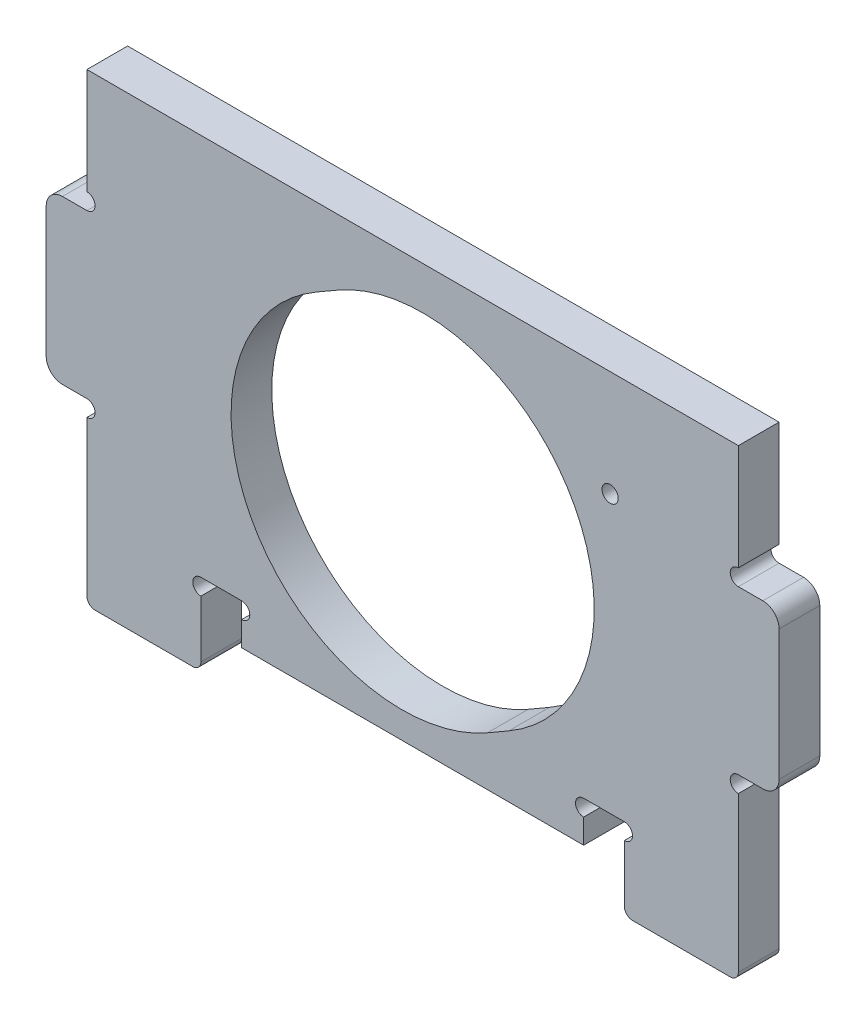
from build123d import *

# Parameters (mm, degrees)
SKETCH_1_W          = 80
SKETCH_1_H          = 52
EXTRUDE_1_DEPTH     = 5
CUT_EXTRUDE_4_DEPTH = 10
SKETCH_9_R          = 1
CUT_EXTRUDE_5_DEPTH = 10
SKETCH_10_W         = 5
SKETCH_10_H         = 5
CUT_EXTRUDE_6_DEPTH = 10
SKETCH_11_R         = 1
CUT_EXTRUDE_7_DEPTH = 10
SKETCH_12_W         = 5
SKETCH_12_H         = 20
EXTRUDE_4_DEPTH     = 5
SKETCH_13_R         = 1
CUT_EXTRUDE_8_DEPTH = 5
FILLET_2_R          = 2
SKETCH_14_W         = 14
SKETCH_14_H         = 5
EXTRUDE_5_DEPTH     = 5
FILLET_3_R          = 1


with BuildPart() as part:
    # 스케치1 → 보스-돌출1 (new body)
    with BuildSketch(Plane.XY):
        with Locations((-10, -8.537755654)):
            Rectangle(SKETCH_1_W, SKETCH_1_H)
    extrude(amount=EXTRUDE_1_DEPTH)

    # 스케치8 → 컷-돌출4 (cut)
    with BuildSketch(Plane(origin=(0, 0, 0), x_dir=(-1, 0, 0), z_dir=(0, 0, -1))):
        with BuildLine():
            Line((19.200961894, 9.398777825), (21.799038106, 7.898777825))
            ThreePointArc((21.799038106, 7.898777825), (29.485571585, -20.787755654), (0.799038106, -28.474289134))
            Line((0.799038106, -28.474289134), (-1.799038106, -26.974289134))
            ThreePointArc((-1.799038106, -26.974289134), (-9.485571585, 1.712244346), (19.200961894, 9.398777825))
        make_face()
    extrude(amount=-CUT_EXTRUDE_4_DEPTH, mode=Mode.SUBTRACT)

    # 스케치9 → 컷-돌출5 (cut)
    with BuildSketch(Plane(origin=(0, 0, 0), x_dir=(-1, 0, 0), z_dir=(0, 0, -1))):
        with Locations((-14.248711306, 4.462244346)):
            Circle(SKETCH_9_R)
    extrude(amount=-CUT_EXTRUDE_5_DEPTH, mode=Mode.SUBTRACT)

    # 스케치10 → 컷-돌출6 (cut)
    with BuildSketch(Plane.XY.offset(5)):
        with Locations((13.5, -32.037755654)):
            Rectangle(SKETCH_10_W, SKETCH_10_H)
        with Locations((-33.5, -32.037755654)):
            Rectangle(SKETCH_10_W, SKETCH_10_H)
    extrude(amount=-CUT_EXTRUDE_6_DEPTH, mode=Mode.SUBTRACT)

    # 스케치11 → 컷-돌출7 (cut)
    with BuildSketch(Plane(origin=(0, 0, 0), x_dir=(-1, 0, 0), z_dir=(0, 0, -1))):
        with Locations((-11, -30.537755654)):
            Circle(SKETCH_11_R)
        with Locations((-16, -30.537755654)):
            Circle(SKETCH_11_R)
        with Locations((31, -30.537755654)):
            Circle(SKETCH_11_R)
        with Locations((36, -30.537755654)):
            Circle(SKETCH_11_R)
    extrude(amount=-CUT_EXTRUDE_7_DEPTH, mode=Mode.SUBTRACT)

    # 스케치12 → 보스-돌출4 (add)
    with BuildSketch(Plane(origin=(0, 0, 0), x_dir=(-1, 0, 0), z_dir=(0, 0, -1))):
        with Locations((52.5, -7.537755654)):
            Rectangle(SKETCH_12_W, SKETCH_12_H)
        with Locations((-32.5, -7.537755654)):
            Rectangle(SKETCH_12_W, SKETCH_12_H)
    extrude(amount=-EXTRUDE_4_DEPTH)

    # 스케치13 → 컷-돌출8 (cut)
    with BuildSketch(Plane(origin=(0, 0, 0), x_dir=(-1, 0, 0), z_dir=(0, 0, -1))):
        with Locations((50, 3.462244346)):
            Circle(SKETCH_13_R)
        with Locations((50, -18.537755654)):
            Circle(SKETCH_13_R)
        with Locations((-30, 3.462244346)):
            Circle(SKETCH_13_R)
        with Locations((-30, -18.537755654)):
            Circle(SKETCH_13_R)
    extrude(amount=-CUT_EXTRUDE_8_DEPTH, mode=Mode.SUBTRACT)

    # 필렛2
    fillet_2_edges = [part.edges().sort_by_distance(p)[0] for p in [
        (35, -17.537755654, 2.5),
        (35, 2.462244346, 2.5),
        (-55, -17.537755654, 2.5),
        (-55, 2.462244346, 2.5),
    ]]
    fillet(fillet_2_edges, radius=FILLET_2_R)

    # 스케치14 → 보스-돌출5 (add)
    with BuildSketch(Plane(origin=(0, 0, 0), x_dir=(-1, 0, 0), z_dir=(0, 0, -1))):
        with Locations((43, -37.037755654)):
            Rectangle(SKETCH_14_W, SKETCH_14_H)
        with Locations((-23, -37.037755654)):
            Rectangle(SKETCH_14_W, SKETCH_14_H)
    extrude(amount=-EXTRUDE_5_DEPTH)

    # 필렛3
    fillet_3_edges = [part.edges().sort_by_distance(p)[0] for p in [
        (30, -39.537755654, 2.5),
        (-36, -39.537755654, 2.5),
        (-50, -39.537755654, 2.5),
        (16, -39.537755654, 2.5),
    ]]
    fillet(fillet_3_edges, radius=FILLET_3_R)


solid = part.part
